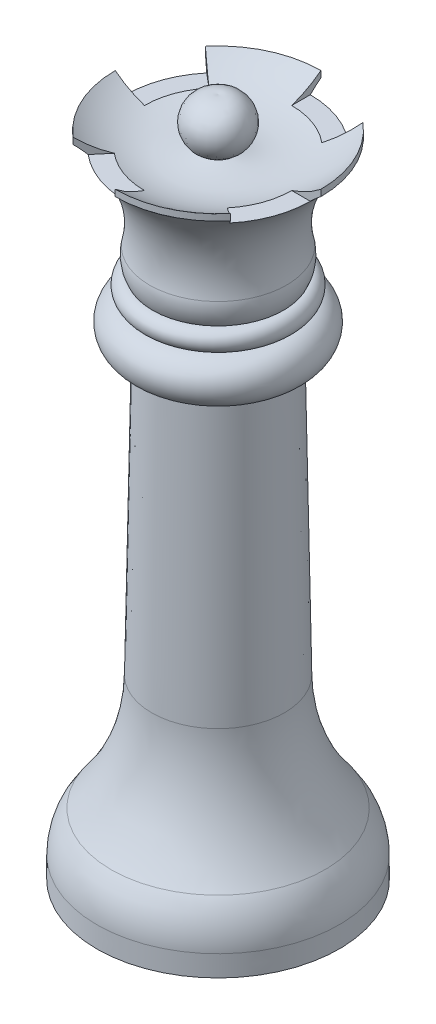
from build123d import *

# Parameters (mm, degrees)
SKETCH10_W          = 9.512793273
SKETCH10_H          = 11.722214066
CUT_REVOLVE8_ANGLE  = 40
SKETCH11_W          = 6.957754191
SKETCH11_H          = 10.596103561
CUT_REVOLVE9_ANGLE  = 40
SKETCH12_W          = 9.203214596
SKETCH12_H          = 11.66204652
CUT_REVOLVE10_ANGLE = 40
SKETCH13_W          = 8.638104201
SKETCH13_H          = 11.887108819
CUT_REVOLVE11_ANGLE = 40
CUT_EXTRUDE1_START  = -0.4
SKETCH8_R           = 10
CUT_EXTRUDE1_DEPTH  = 2.4


with BuildPart() as part:
    # Sketch1 → Revolve6 (revolve)
    with BuildSketch(Plane.XY):
        with BuildLine():
            Line((-11.6, 0), (0, 0))
            Line((0, 0), (0, 65))
            ThreePointArc((0, 65), (-2.670285452, 63.315824128), (-1.207945055, 60.517890367))
            ThreePointArc((-1.207945055, 60.517890367), (-5.713617748, 60.221219504), (-9.83725582, 62.060977386))
            Line((-9.83725582, 62.060977386), (-9.83725582, 61.446621373))
            ThreePointArc((-9.83725582, 61.446621373), (-6.855122072, 57.446707659), (-6.5462636, 52.467045236))
            ThreePointArc((-6.5462636, 52.467045236), (-6.602958864, 51.327795265), (-6.259730665, 50.239999672))
            ThreePointArc((-6.259730665, 50.239999672), (-7.244947935, 49.268175675), (-6.286634877, 48.269811497))
            ThreePointArc((-6.286634877, 48.269811497), (-8.418356224, 46.223574851), (-6.343236917, 44.119958876))
            Line((-6.343236917, 44.119958876), (-5.873433999, 44.119958876))
            Line((-5.873433999, 44.119958876), (-6.343236917, 16.936018409))
            ThreePointArc((-6.343236917, 16.936018409), (-7.365159743, 11.085952185), (-10.229600334, 5.88378137))
            ThreePointArc((-10.229600334, 5.88378137), (-11.234646656, 4.055708482), (-11.589655426, 2))
            Line((-11.589655426, 2), (-11.6, 0))
        make_face()
    revolve(axis=Axis((0, 65, 0), (0, -1, 0)))

    # Sketch10 → Cut-Revolve8 (revolve, cut)
    with BuildSketch(Plane.XY):
        with Locations((-9.83725582, 66.422084419)):
            Rectangle(SKETCH10_W, SKETCH10_H)
    revolve(axis=Axis((0, 0, 0), (0, -1, 0)), revolution_arc=CUT_REVOLVE8_ANGLE, mode=Mode.SUBTRACT)

    # Sketch11 → Cut-Revolve9 (revolve, cut)
    with BuildSketch(Plane.XY):
        with Locations((9.83725582, 65.859029167)):
            Rectangle(SKETCH11_W, SKETCH11_H)
    revolve(axis=Axis((0, 0, 0), (0, -1, 0)), revolution_arc=CUT_REVOLVE9_ANGLE, mode=Mode.SUBTRACT)

    # Sketch12 → Cut-Revolve10 (revolve, cut)
    with BuildSketch(Plane(origin=(0, 0, 0), x_dir=(0, 0, -1), z_dir=(1, 0, 0))):
        with Locations((9.83725582, 66.392000646)):
            Rectangle(SKETCH12_W, SKETCH12_H)
    revolve(axis=Axis((0, 0, 0), (0, -1, 0)), revolution_arc=CUT_REVOLVE10_ANGLE, mode=Mode.SUBTRACT)

    # Sketch13 → Cut-Revolve11 (revolve, cut)
    with BuildSketch(Plane(origin=(0, 0, 0), x_dir=(0, 0, -1), z_dir=(1, 0, 0))):
        with Locations((-9.83725582, 66.504531796)):
            Rectangle(SKETCH13_W, SKETCH13_H)
    revolve(axis=Axis((0, 0, 0), (0, -1, 0)), revolution_arc=CUT_REVOLVE11_ANGLE, mode=Mode.SUBTRACT)

    # Sketch8 → Cut-Extrude1 (cut)
    with BuildSketch(Plane.XZ.offset(CUT_EXTRUDE1_START)):
        Circle(SKETCH8_R)
    extrude(amount=-CUT_EXTRUDE1_DEPTH, mode=Mode.SUBTRACT)


solid = part.part
